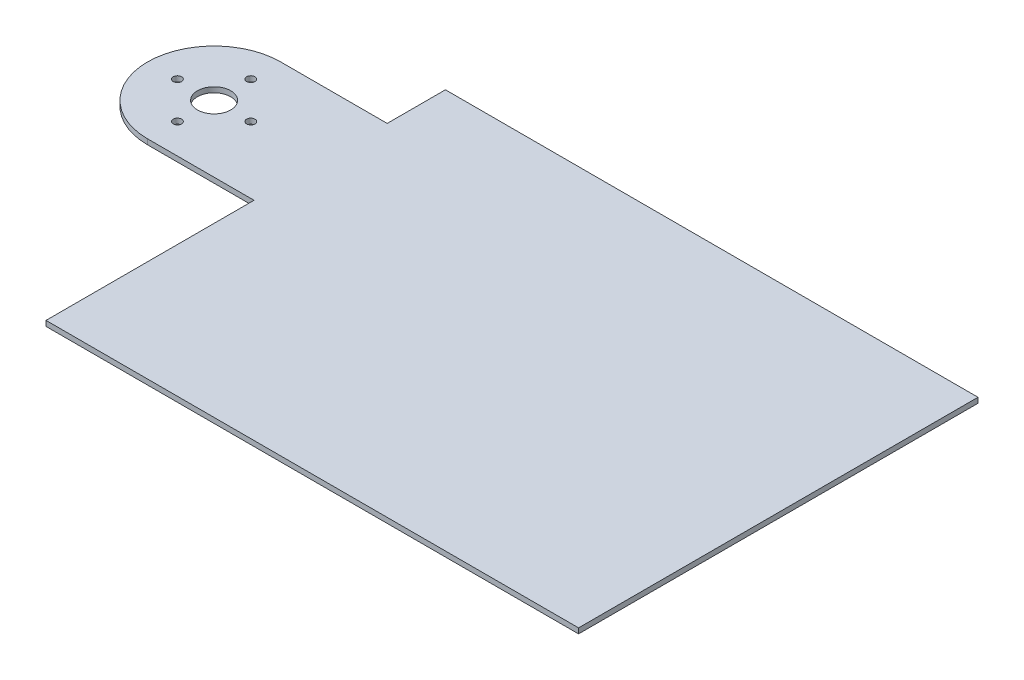
from build123d import *

# Parameters (mm, degrees)
SKETCH1_R           = 0.800000051
SKETCH1_R_2         = 3.175
BOSS_EXTRUDE1_DEPTH = 0.500000016


with BuildPart() as part:
    # Sketch1 → Boss-Extrude1 (new, symmetric)
    with BuildSketch(Plane(origin=(0, 0, 0), x_dir=(1, 0, 0), z_dir=(0, 1, 0))):
        with BuildLine():
            Line((0, 12.7), (20.32, 12.7))
            Line((20.32, 12.7), (20.32, 23.8125))
            Line((20.32, 23.8125), (121.92, 23.8125))
            Line((121.92, 23.8125), (121.92, -52.3875))
            Line((121.92, -52.3875), (20.32, -52.3875))
            Line((20.32, -52.3875), (20.32, -12.7))
            Line((20.32, -12.7), (0, -12.7))
            ThreePointArc((0, -12.7), (-12.7, 0), (0, 12.7))
        make_face()
        with Locations((6.99999997, 0)):
            Circle(SKETCH1_R, mode=Mode.SUBTRACT)
        with Locations((0, -6.99999997)):
            Circle(SKETCH1_R, mode=Mode.SUBTRACT)
        with Locations((-6.99999997, 0)):
            Circle(SKETCH1_R, mode=Mode.SUBTRACT)
        with Locations((0, 6.99999997)):
            Circle(SKETCH1_R, mode=Mode.SUBTRACT)
        Circle(SKETCH1_R_2, mode=Mode.SUBTRACT)
    extrude(amount=BOSS_EXTRUDE1_DEPTH, both=True)


solid = part.part
